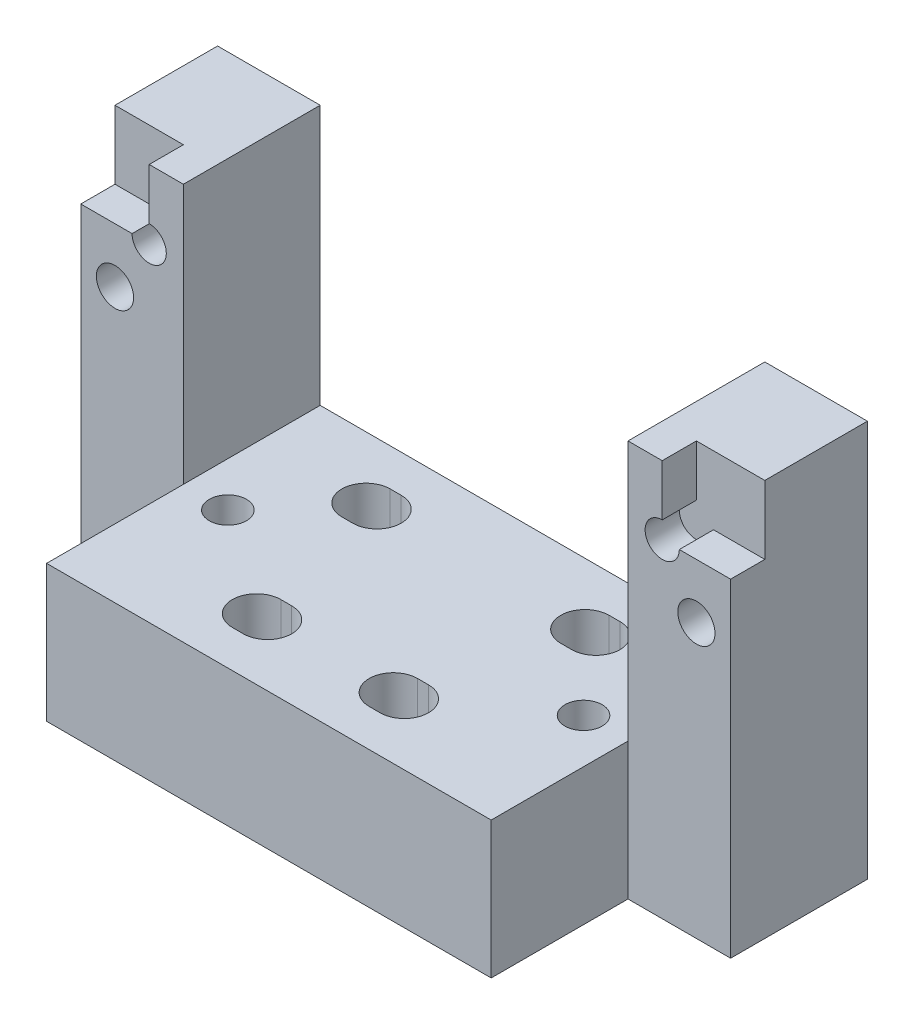
from build123d import *

# Parameters (mm, degrees)
SKETCH1_W                                     = 60.325
SKETCH1_H                                     = 25.4
BOSS_EXTRUDE1_DEPTH                           = 18.415
SKETCH2_W                                     = 41.275
SKETCH2_H                                     = 24.13
CUT_EXTRUDE1_DEPTH                            = 44.520669012
SKETCH3_W                                     = 12.7
SKETCH3_H                                     = 36.83
CUT_EXTRUDE2_DEPTH                            = 9.525
SKETCH4_W                                     = 6.35
SKETCH4_H                                     = 6.35
CUT_EXTRUDE3_DEPTH                            = 3.175
SKETCH5_R                                     = 1.5875
CUT_EXTRUDE4_DEPTH                            = 3.175
F_8_32_TAPPED_HOLE1_D                         = 3.4544
F_8_32_TAPPED_HOLE2_D                         = 3.4544
CBORE_START                                   = -18.415
CBORE_SLOT_FOR_8_SOCKET_HEAD_CAP_SCREW1_DEPTH = 12.7
CBORE_SLOT_FOR_8_SOCKET_HEAD_CAP_SC_3_DEPTH   = 4.1656


# Read off the part's stored shape, not the designer's step: CBORE SLOT for #8 Socket Head Cap Screw1
with BuildPart() as part:
    # Sketch1 → Boss-Extrude1 (new, symmetric)
    with BuildSketch(Plane(origin=(0, 0, 0), x_dir=(1, 0, 0), z_dir=(0, 1, 0))):
        Rectangle(SKETCH1_W, SKETCH1_H)
    extrude(amount=BOSS_EXTRUDE1_DEPTH, both=True)

    # Sketch2 → Cut-Extrude1 (cut, through all)
    with BuildSketch(Plane.XY.offset(12.7)):
        with Locations((0, 6.35)):
            Rectangle(SKETCH2_W, SKETCH2_H)
    extrude(amount=-CUT_EXTRUDE1_DEPTH, mode=Mode.SUBTRACT)

    # Sketch3 → Cut-Extrude2 (cut)
    with BuildSketch(Plane(origin=(30.1625, 0, 0), x_dir=(0, 0, -1), z_dir=(1, 0, 0))):
        with Locations((-6.35, 0)):
            Rectangle(SKETCH3_W, SKETCH3_H)
    cut_extrude2 = extrude(amount=-CUT_EXTRUDE2_DEPTH, mode=Mode.SUBTRACT)

    # Sketch4 → Cut-Extrude3 (cut)
    with BuildSketch(Plane.XY):
        with Locations((26.9875, 15.24)):
            Rectangle(SKETCH4_W, SKETCH4_H)
    cut_extrude3 = extrude(amount=-CUT_EXTRUDE3_DEPTH, mode=Mode.SUBTRACT)

    # Sketch5 → Cut-Extrude4 (cut)
    with BuildSketch(Plane.XY):
        with Locations((23.8125, 12.065)):
            Circle(SKETCH5_R)
    cut_extrude4 = extrude(amount=-CUT_EXTRUDE4_DEPTH, mode=Mode.SUBTRACT)

    # #8-32 Tapped Hole1 (through all)
    with Locations(Plane.XY):
        with Locations((26.9875, 6.985)):
            f_8_32_tapped_hole1 = Hole(F_8_32_TAPPED_HOLE1_D / 2)

    # Mirror1: Cut-Extrude2, Cut-Extrude3, Cut-Extrude4, #8-32 Tapped Hole1 across plane
    add(cut_extrude2.mirror(Plane(origin=(0, 0, 0), x_dir=(0, 0, 1), z_dir=(1, 0, 0))), mode=Mode.SUBTRACT)
    add(cut_extrude3.mirror(Plane(origin=(0, 0, 0), x_dir=(0, 0, 1), z_dir=(1, 0, 0))), mode=Mode.SUBTRACT)
    add(cut_extrude4.mirror(Plane(origin=(0, 0, 0), x_dir=(0, 0, 1), z_dir=(1, 0, 0))), mode=Mode.SUBTRACT)
    add(f_8_32_tapped_hole1.mirror(Plane(origin=(0, 0, 0), x_dir=(0, 0, 1), z_dir=(1, 0, 0))), mode=Mode.SUBTRACT)

    # #8-32 Tapped Hole2 (through all)
    with Locations(Plane(origin=(0, -18.415, 0), x_dir=(-1, 0, 0), z_dir=(0, -1, 0))):
        with Locations((16.51, 0)):
            f_8_32_tapped_hole2 = Hole(F_8_32_TAPPED_HOLE2_D / 2)

    # CBORE SLOT for _8 Socket Head Cap Sc 2 → CBORE SLOT for #8 Socket Head Cap Screw1 (cut)
    with BuildSketch(Plane(origin=(0, 0, 0), x_dir=(1, 0, 0), z_dir=(0, 1, 0)).offset(CBORE_START)):
        with BuildLine():
            ThreePointArc((-9.652, 4.7371), (-7.4041, 6.985), (-9.652, 9.2329))
            Line((-9.652, 9.2329), (-10.668, 9.2329))
            ThreePointArc((-10.668, 9.2329), (-12.9159, 6.985), (-10.668, 4.7371))
            Line((-10.668, 4.7371), (-9.652, 4.7371))
        make_face()
        with BuildLine():
            ThreePointArc((9.652, 9.2329), (7.4041, 6.985), (9.652, 4.7371))
            Line((9.652, 4.7371), (10.668, 4.7371))
            ThreePointArc((10.668, 4.7371), (12.9159, 6.985), (10.668, 9.2329))
            Line((10.668, 9.2329), (9.652, 9.2329))
        make_face()
        with BuildLine():
            ThreePointArc((6.858, -9.2329), (9.1059, -6.985), (6.858, -4.7371))
            Line((6.858, -4.7371), (5.842, -4.7371))
            ThreePointArc((5.842, -4.7371), (3.5941, -6.985), (5.842, -9.2329))
            Line((5.842, -9.2329), (6.858, -9.2329))
        make_face()
        with BuildLine():
            ThreePointArc((-6.858, -4.7371), (-9.1059, -6.985), (-6.858, -9.2329))
            Line((-6.858, -9.2329), (-5.842, -9.2329))
            ThreePointArc((-5.842, -9.2329), (-3.5941, -6.985), (-5.842, -4.7371))
            Line((-5.842, -4.7371), (-6.858, -4.7371))
        make_face()
    extrude(amount=CBORE_SLOT_FOR_8_SOCKET_HEAD_CAP_SCREW1_DEPTH, mode=Mode.SUBTRACT)

    # CBORE SLOT for _8 Socket Head Cap Sc 3 o → CBORE SLOT for _8 Socket Head Cap Sc 3 (cut)
    # profile 1 of 4: a face of its own
    with BuildSketch(Plane(origin=(0, 0, 0), x_dir=(1, 0, 0), z_dir=(0, 1, 0)).offset(CBORE_START)):
        with BuildLine():
            ThreePointArc((-9.652, 3.01625), (-5.68325, 6.985), (-9.652, 10.95375))
            Line((-9.652, 10.95375), (-10.668, 10.95375))
            ThreePointArc((-10.668, 10.95375), (-14.63675, 6.985), (-10.668, 3.01625))
            Line((-10.668, 3.01625), (-9.652, 3.01625))
        make_face()
        with BuildLine():
            Line((-10.668, 9.2329), (-9.652, 9.2329))
            ThreePointArc((-9.652, 9.2329), (-7.4041, 6.985), (-9.652, 4.7371))
            Line((-9.652, 4.7371), (-10.668, 4.7371))
            ThreePointArc((-10.668, 4.7371), (-12.9159, 6.985), (-10.668, 9.2329))
        make_face(mode=Mode.SUBTRACT)
    # profile 2 of 4: a face of its own
    with BuildSketch(Plane(origin=(0, 0, 0), x_dir=(1, 0, 0), z_dir=(0, 1, 0)).offset(CBORE_START)):
        with BuildLine():
            ThreePointArc((9.652, 10.95375), (5.68325, 6.985), (9.652, 3.01625))
            Line((9.652, 3.01625), (10.668, 3.01625))
            ThreePointArc((10.668, 3.01625), (14.63675, 6.985), (10.668, 10.95375))
            Line((10.668, 10.95375), (9.652, 10.95375))
        make_face()
        with BuildLine():
            Line((10.668, 4.7371), (9.652, 4.7371))
            ThreePointArc((9.652, 4.7371), (7.4041, 6.985), (9.652, 9.2329))
            Line((9.652, 9.2329), (10.668, 9.2329))
            ThreePointArc((10.668, 9.2329), (12.9159, 6.985), (10.668, 4.7371))
        make_face(mode=Mode.SUBTRACT)
    # profile 3 of 4: a face of its own
    with BuildSketch(Plane(origin=(0, 0, 0), x_dir=(1, 0, 0), z_dir=(0, 1, 0)).offset(CBORE_START)):
        with BuildLine():
            ThreePointArc((6.858, -10.95375), (10.82675, -6.985), (6.858, -3.01625))
            Line((6.858, -3.01625), (5.842, -3.01625))
            ThreePointArc((5.842, -3.01625), (1.87325, -6.985), (5.842, -10.95375))
            Line((5.842, -10.95375), (6.858, -10.95375))
        make_face()
        with BuildLine():
            Line((5.842, -4.7371), (6.858, -4.7371))
            ThreePointArc((6.858, -4.7371), (9.1059, -6.985), (6.858, -9.2329))
            Line((6.858, -9.2329), (5.842, -9.2329))
            ThreePointArc((5.842, -9.2329), (3.5941, -6.985), (5.842, -4.7371))
        make_face(mode=Mode.SUBTRACT)
    # profile 4 of 4: a face of its own
    with BuildSketch(Plane(origin=(0, 0, 0), x_dir=(1, 0, 0), z_dir=(0, 1, 0)).offset(CBORE_START)):
        with BuildLine():
            ThreePointArc((-6.858, -3.01625), (-10.82675, -6.985), (-6.858, -10.95375))
            Line((-6.858, -10.95375), (-5.842, -10.95375))
            ThreePointArc((-5.842, -10.95375), (-1.87325, -6.985), (-5.842, -3.01625))
            Line((-5.842, -3.01625), (-6.858, -3.01625))
        make_face()
        with BuildLine():
            Line((-5.842, -9.2329), (-6.858, -9.2329))
            ThreePointArc((-6.858, -9.2329), (-9.1059, -6.985), (-6.858, -4.7371))
            Line((-6.858, -4.7371), (-5.842, -4.7371))
            ThreePointArc((-5.842, -4.7371), (-3.5941, -6.985), (-5.842, -9.2329))
        make_face(mode=Mode.SUBTRACT)
    extrude(amount=CBORE_SLOT_FOR_8_SOCKET_HEAD_CAP_SC_3_DEPTH, mode=Mode.SUBTRACT)

    # Mirror2: #8-32 Tapped Hole2 across plane
    add(f_8_32_tapped_hole2.mirror(Plane(origin=(0, 0, 0), x_dir=(0, 0, 1), z_dir=(1, 0, 0))), mode=Mode.SUBTRACT)


solid = part.part
